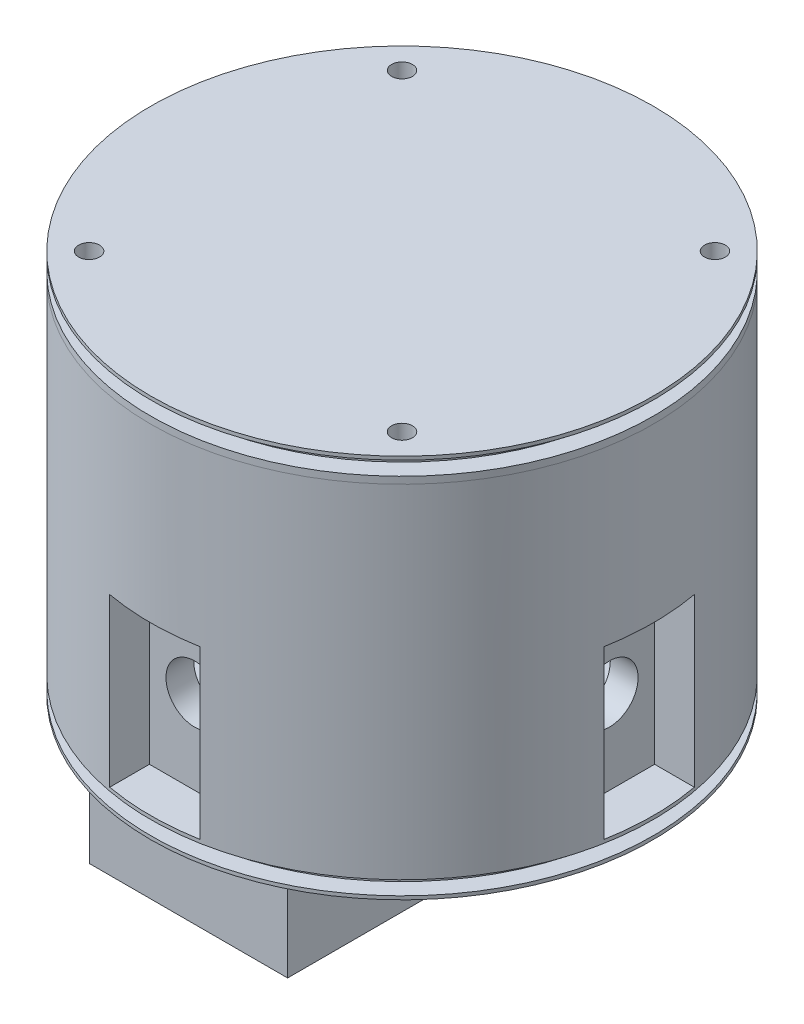
from build123d import *

# Parameters (mm, degrees)
EXTRUDE_START            = -2
SKETCH_1_R               = 72.25
EXTRUDE_8_DEPTH          = 99.5
SKETCH_5_W               = 10.5
SKETCH_5_H               = 22
SKETCH_5_W_2             = 22
SKETCH_5_H_2             = 10.5
CUT_EXTRUDE_1_DEPTH      = 48
SKETCH_40_R              = 8.25
CUT_EXTRUDE_2_DEPTH      = 8
PATTERN_CIRCULAR_1_COUNT = 4
SHELL_START              = -49.642711667
SHELL_6_OUTLINE_W        = 30
SHELL_6_OUTLINE_H        = 50
SHELL_6_DEPTH            = 99.285423334
SHELL_START_2            = -57.642711667
SHELL_6_2_OUTLINE_W      = 30
SHELL_6_2_OUTLINE_H      = 50
SHELL_6_2_OUTLINE_R      = 10.25
SHELL_6_2_DEPTH          = 115.285423334
SHELL_6_3_OUTLINE_W      = 50
SHELL_6_3_OUTLINE_H      = 30
SHELL_6_3_DEPTH          = 99.285423334
SHELL_6_4_OUTLINE_W      = 50
SHELL_6_4_OUTLINE_H      = 30
SHELL_6_4_OUTLINE_R      = 10.25
SHELL_6_4_DEPTH          = 115.285423334
SHELL_6_5_DEPTH          = 97.5
SHELL_START_3            = 50
SHELL_6_6_DEPTH          = 47.5
CUT_EXTRUDE_5_DEPTH      = 48
SKETCH_37_W              = 68
SKETCH_37_H              = 1.5
EXTRUDE_9_DEPTH          = 34
EXTRUDE_9_2_DEPTH        = 34
EXTRUDE_9_3_DEPTH        = 34
EXTRUDE_9_4_DEPTH        = 34
EXTRUDE_9_5_DEPTH        = 34
EXTRUDE_10_DEPTH         = 65
EXTRUDE_11_DEPTH         = 55
EXTRUDE_START_2          = -6
SKETCH_1_26_R            = 72.25
EXTRUDE_13_DEPTH         = 6
SKETCH_47_W              = 57
SKETCH_47_H              = 106
EXTRUDE_12_DEPTH         = 34
SKETCH_50_R              = 6
CUT_EXTRUDE_6_DEPTH      = 6
EXTRUDE_START_3          = 91.5
SKETCH_1_36_R            = 72.25
SKETCH_1_36_R_2          = 71
SKETCH_1_36_R_3          = 68
SKETCH_1_36_R_4          = 67
EXTRUDE_19_DEPTH         = 6
CUT_EXTRUDE_START        = 97.5
SKETCH_1_37_R            = 71
SKETCH_1_37_R_2          = 68
CUT_EXTRUDE_11_DEPTH     = 2
EXTRUDE_START_4          = -97.5
EXTRUDE_20_DEPTH         = 6
SKETCH_62_W              = 5
SKETCH_62_H              = 4
SKETCH_63_R              = 1.5
CUT_EXTRUDE_12_DEPTH     = 6
EXTRUDE_START_5          = 97.5
SKETCH_1_39_R            = 72.25
EXTRUDE_22_DEPTH         = 7
SKETCH_64_R              = 3
CUT_EXTRUDE_13_DEPTH     = 6
CUT_EXTRUDE_START_2      = 6
SKETCH_63_2_R            = 1.5
CUT_EXTRUDE_14_DEPTH     = 6
SKETCH_65_R              = 1.5
CUT_EXTRUDE_15_DEPTH     = 6
SKETCH_66_W              = 5
SKETCH_66_H              = 4
SKETCH_1_41_R            = 68
SKETCH_1_41_R_2          = 67
EXTRUDE_24_DEPTH         = 6
SKETCH_61_R              = 1.5
CUT_EXTRUDE_16_DEPTH     = 6
PATTERN_CIRCULAR_2_COUNT = 4


with BuildPart() as part:
    # 草圖1 → 填料-伸長8 (new body)
    with BuildSketch(Plane(origin=(0, 0, 0), x_dir=(1, 0, 0), z_dir=(0, 1, 0)).offset(EXTRUDE_START)):
        with Locations(Location((0, 0, 0), (0, 0, 270))):
            Circle(SKETCH_1_R)
    extrude(amount=EXTRUDE_8_DEPTH)

    # 草圖5 → 除料-伸長1 (cut)
    with BuildSketch(Plane(origin=(0, 0, 0), x_dir=(1, 0, 0), z_dir=(0, 1, 0))):
        with Locations((64.892711667, 0)):
            Rectangle(SKETCH_5_W, SKETCH_5_H)
        with BuildLine():
            ThreePointArc((72.25, 0), (71.954602966, 6.526684613), (71.070827348, 13))
            Line((71.070827348, 13), (59.642711667, 13))
            Line((59.642711667, 13), (59.642711667, 11))
            Line((59.642711667, 11), (70.142711667, 11))
            Line((70.142711667, 11), (70.142711667, -11))
            Line((70.142711667, -11), (59.642711667, -11))
            Line((59.642711667, -11), (59.642711667, -13))
            Line((59.642711667, -13), (71.070827348, -13))
            ThreePointArc((71.070827348, -13), (71.954602966, -6.526684613), (72.25, 0))
        make_face()
        with Locations((0, 64.892711667)):
            Rectangle(SKETCH_5_W_2, SKETCH_5_H_2)
        with BuildLine():
            ThreePointArc((13, 71.070827348), (0, 72.25), (-13, 71.070827348))
            Line((-13, 71.070827348), (-13, 59.642711667))
            Line((-13, 59.642711667), (-11, 59.642711667))
            Line((-11, 59.642711667), (-11, 70.142711667))
            Line((-11, 70.142711667), (11, 70.142711667))
            Line((11, 70.142711667), (11, 59.642711667))
            Line((11, 59.642711667), (13, 59.642711667))
            Line((13, 59.642711667), (13, 71.070827348))
        make_face()
        with Locations((-64.892711667, 0)):
            Rectangle(SKETCH_5_W, SKETCH_5_H)
        with BuildLine():
            Line((-70.142711667, -11), (-70.142711667, 11))
            Line((-70.142711667, 11), (-59.642711667, 11))
            Line((-59.642711667, 11), (-59.642711667, 13))
            Line((-59.642711667, 13), (-71.070827348, 13))
            ThreePointArc((-71.070827348, 13), (-72.25, 0), (-71.070827348, -13))
            Line((-71.070827348, -13), (-59.642711667, -13))
            Line((-59.642711667, -13), (-59.642711667, -11))
            Line((-59.642711667, -11), (-70.142711667, -11))
        make_face()
        with Locations((0, -64.892711667)):
            Rectangle(SKETCH_5_W_2, SKETCH_5_H_2)
        with BuildLine():
            Line((-13, -59.642711667), (-13, -71.070827348))
            ThreePointArc((-13, -71.070827348), (0, -72.25), (13, -71.070827348))
            Line((13, -71.070827348), (13, -59.642711667))
            Line((13, -59.642711667), (11, -59.642711667))
            Line((11, -59.642711667), (11, -70.142711667))
            Line((11, -70.142711667), (-11, -70.142711667))
            Line((-11, -70.142711667), (-11, -59.642711667))
            Line((-11, -59.642711667), (-13, -59.642711667))
        make_face()
    extrude(amount=CUT_EXTRUDE_1_DEPTH, mode=Mode.SUBTRACT)

    # 草圖40 → 除料-伸長2 (cut)
    with BuildSketch(Plane(origin=(0, 0, -59.642711667), x_dir=(-1, 0, 0), z_dir=(0, 0, -1))):
        with Locations((0, 24)):
            Circle(SKETCH_40_R)
    cut_extrude_2 = extrude(amount=-CUT_EXTRUDE_2_DEPTH, mode=Mode.SUBTRACT)

    # 環狀複製排列1: 除料-伸長2 ×4 about axis
    pattern_circular_1_axis = Axis((0, 0, 0), (0, 1, 0))
    for i in range(1, PATTERN_CIRCULAR_1_COUNT):
        add(cut_extrude_2.rotate(pattern_circular_1_axis, i * 360 / PATTERN_CIRCULAR_1_COUNT), mode=Mode.SUBTRACT)

    # 薄殼6: read off the stored shape, not the designer's step
    # 薄殼6 outline → 薄殼6 (cut)
    with BuildSketch(Plane.XY.offset(SHELL_START)):
        with Locations((0, 25)):
            Rectangle(SHELL_6_OUTLINE_W, SHELL_6_OUTLINE_H)
    extrude(amount=SHELL_6_DEPTH, mode=Mode.SUBTRACT)

    # Shell 6 2 outline → Shell 6 2 (cut)
    with BuildSketch(Plane.XY.offset(SHELL_START_2)):
        with Locations((0, 25)):
            Rectangle(SHELL_6_2_OUTLINE_W, SHELL_6_2_OUTLINE_H)
        with Locations((0, 24)):
            Circle(SHELL_6_2_OUTLINE_R, mode=Mode.SUBTRACT)
    extrude(amount=SHELL_6_2_DEPTH, mode=Mode.SUBTRACT)

    # Shell 6 3 outline → Shell 6 3 (cut)
    with BuildSketch(Plane.YZ.offset(SHELL_START)):
        with Locations((25, 0)):
            Rectangle(SHELL_6_3_OUTLINE_W, SHELL_6_3_OUTLINE_H)
    extrude(amount=SHELL_6_3_DEPTH, mode=Mode.SUBTRACT)

    # Shell 6 4 outline → Shell 6 4 (cut)
    with BuildSketch(Plane.YZ.offset(SHELL_START_2)):
        with Locations((25, 0)):
            Rectangle(SHELL_6_4_OUTLINE_W, SHELL_6_4_OUTLINE_H)
        with Locations((24, 0)):
            Circle(SHELL_6_4_OUTLINE_R, mode=Mode.SUBTRACT)
    extrude(amount=SHELL_6_4_DEPTH, mode=Mode.SUBTRACT)

    # Shell 6 5 outline → Shell 6 5 (cut)
    with BuildSketch(Plane(origin=(0, 0, 0), x_dir=(1, 0, 0), z_dir=(0, 1, 0))):
        with BuildLine():
            Line((15, 15), (68.62989509, 15))
            ThreePointArc((68.62989509, 15), (49.674251378, 49.674251378), (15, 68.62989509))
            Line((15, 68.62989509), (15, 15))
        make_face()
        with BuildLine():
            ThreePointArc((15, -68.62989509), (49.674251378, -49.674251378), (68.62989509, -15))
            Line((68.62989509, -15), (15, -15))
            Line((15, -15), (15, -68.62989509))
        make_face()
        with BuildLine():
            Line((-15, 15), (-15, 68.62989509))
            ThreePointArc((-15, 68.62989509), (-49.674251378, 49.674251378), (-68.62989509, 15))
            Line((-68.62989509, 15), (-15, 15))
        make_face()
        with BuildLine():
            ThreePointArc((-68.62989509, -15), (-49.674251378, -49.674251378), (-15, -68.62989509))
            Line((-15, -68.62989509), (-15, -15))
            Line((-15, -15), (-68.62989509, -15))
        make_face()
    extrude(amount=SHELL_6_5_DEPTH, mode=Mode.SUBTRACT)

    # Shell 6 6 outline → Shell 6 6 (cut)
    with BuildSketch(Plane(origin=(0, 0, 0), x_dir=(1, 0, 0), z_dir=(0, 1, 0)).offset(SHELL_START_3)):
        with BuildLine():
            ThreePointArc((68.62989509, -15), (70.25, 0), (68.62989509, 15))
            Line((68.62989509, 15), (15, 15))
            Line((15, 15), (15, 68.62989509))
            ThreePointArc((15, 68.62989509), (0, 70.25), (-15, 68.62989509))
            Line((-15, 68.62989509), (-15, 15))
            Line((-15, 15), (-68.62989509, 15))
            ThreePointArc((-68.62989509, 15), (-70.25, 0), (-68.62989509, -15))
            Line((-68.62989509, -15), (-15, -15))
            Line((-15, -15), (-15, -68.62989509))
            ThreePointArc((-15, -68.62989509), (0, -70.25), (15, -68.62989509))
            Line((15, -68.62989509), (15, -15))
            Line((15, -15), (68.62989509, -15))
        make_face()
    extrude(amount=SHELL_6_6_DEPTH, mode=Mode.SUBTRACT)

    # 草圖43 → 除料-伸長5 (cut)
    with BuildSketch(Plane(origin=(0, 0, 0), x_dir=(1, 0, 0), z_dir=(0, 1, 0))):
        Polygon((15.617248129, 51.642711667), (-24.146545114, 51.642711667), (-51.642711667, 15.617248129), (-51.642711667, -24.146545114), (-15.617248129, -51.642711667), (24.146545114, -51.642711667), (51.642711667, -15.617248129), (51.642711667, 24.146545114), align=None)
    extrude(amount=CUT_EXTRUDE_5_DEPTH, mode=Mode.SUBTRACT)

    # 草圖1<26> → 填料-伸長13 (add)
    with BuildSketch(Plane(origin=(0, 0, 0), x_dir=(1, 0, 0), z_dir=(0, 1, 0)).offset(EXTRUDE_START_2)):
        with Locations(Location((0, 0, 0), (0, 0, 270))):
            Circle(SKETCH_1_26_R)
    extrude(amount=EXTRUDE_13_DEPTH)

    # 草圖50 → 除料-伸長6 (cut)
    with BuildSketch(Plane(origin=(0, 0, 0), x_dir=(1, 0, 0), z_dir=(0, 1, 0))):
        with Locations(Location((18.322761596, 49.972985564, 0), (0, 0, 270))):
            Circle(SKETCH_50_R)
        with Locations(Location((-49.972985564, -18.322761596, 0), (0, 0, 270))):
            Circle(SKETCH_50_R)
    extrude(amount=-CUT_EXTRUDE_6_DEPTH, mode=Mode.SUBTRACT)

    # 草圖1<36> → 填料-伸長19 (add)
    # profile 1 of 3: a face of its own
    with BuildSketch(Plane(origin=(0, 0, 0), x_dir=(1, 0, 0), z_dir=(0, 1, 0)).offset(EXTRUDE_START_3)):
        with Locations(Location((0, 0, 0), (0, 0, 270))):
            Circle(SKETCH_1_36_R)
        Circle(SKETCH_1_36_R_2, mode=Mode.SUBTRACT)
    # profile 2 of 3: a face of its own
    with BuildSketch(Plane(origin=(0, 0, 0), x_dir=(1, 0, 0), z_dir=(0, 1, 0)).offset(EXTRUDE_START_3)):
        Circle(SKETCH_1_36_R_2)
        Circle(SKETCH_1_36_R_3, mode=Mode.SUBTRACT)
    # profile 3 of 3: a face of its own
    with BuildSketch(Plane(origin=(0, 0, 0), x_dir=(1, 0, 0), z_dir=(0, 1, 0)).offset(EXTRUDE_START_3)):
        Circle(SKETCH_1_36_R_3)
        with Locations(Location((0, 0, 0), (0, 0, 270))):
            Circle(SKETCH_1_36_R_4, mode=Mode.SUBTRACT)
    extrude(amount=EXTRUDE_19_DEPTH)

    # 草圖1<37> → 除料-伸長11 (cut)
    with BuildSketch(Plane(origin=(0, 0, 0), x_dir=(1, 0, 0), z_dir=(0, 1, 0)).offset(CUT_EXTRUDE_START)):
        with Locations(Location((0, 0, 0), (0, 0, 270))):
            Circle(SKETCH_1_37_R)
        with Locations(Location((0, 0, 0), (0, 0, 270))):
            Circle(SKETCH_1_37_R_2, mode=Mode.SUBTRACT)
    extrude(amount=-CUT_EXTRUDE_11_DEPTH, mode=Mode.SUBTRACT)

    # 草圖57 → 填料-伸長20 (add)
    with BuildSketch(Plane.XZ.offset(6).offset(EXTRUDE_START_4)):
        with BuildLine():
            Line((-49.280774487, 45.39168719), (-45, 41.110912703))
            Line((-45, 41.110912703), (-41.110912703, 45))
            Line((-41.110912703, 45), (-45.39168719, 49.280774487))
            ThreePointArc((-45.39168719, 49.280774487), (-47.376154339, 47.376154339), (-49.280774487, 45.39168719))
        make_face()
        with BuildLine():
            Line((-45, -41.110912703), (-49.280774487, -45.39168719))
            ThreePointArc((-49.280774487, -45.39168719), (-47.376154339, -47.376154339), (-45.39168719, -49.280774487))
            Line((-45.39168719, -49.280774487), (-41.110912703, -45))
            Line((-41.110912703, -45), (-45, -41.110912703))
        make_face()
        with BuildLine():
            Line((41.110912703, -45), (45.39168719, -49.280774487))
            ThreePointArc((45.39168719, -49.280774487), (47.376154339, -47.376154339), (49.280774487, -45.39168719))
            Line((49.280774487, -45.39168719), (45, -41.110912703))
            Line((45, -41.110912703), (41.110912703, -45))
        make_face()
        with BuildLine():
            ThreePointArc((49.280774487, 45.39168719), (47.376154339, 47.376154339), (45.39168719, 49.280774487))
            Line((45.39168719, 49.280774487), (41.110912703, 45))
            Line((41.110912703, 45), (45, 41.110912703))
            Line((45, 41.110912703), (49.280774487, 45.39168719))
        make_face()
    extrude(amount=-EXTRUDE_20_DEPTH)

    # 草圖62 → 除料-旋轉2 (revolve, cut)
    with BuildSketch(Plane(origin=(0, 0, 0), x_dir=(-0.7071067811865476, 0, 0.7071067811865476), z_dir=(-0.7071067811865476, 0, -0.7071067811865476)), mode=Mode.PRIVATE) as cut_revolve_2_sk:
        with Locations((-69.75, -3)):
            Rectangle(SKETCH_62_W, SKETCH_62_H)
    revolve(cut_revolve_2_sk.sketch.rotate(Axis((0, 0, 0), (0, 1, 0)), 45), axis=Axis((0, 0, 0), (0, 1, 0)), mode=Mode.SUBTRACT)

    # 草圖63 → 除料-伸長12 (cut)
    with BuildSketch(Plane(origin=(0, 97.5, 0), x_dir=(1, 0, 0), z_dir=(0, 1, 0))):
        with Locations(Location((-45, 45, 0), (0, 0, 270))):
            Circle(SKETCH_63_R)
        with Locations(Location((45, 45, 0), (0, 0, 270))):
            Circle(SKETCH_63_R)
        with Locations(Location((45, -45, 0), (0, 0, 270))):
            Circle(SKETCH_63_R)
        with Locations(Location((-45, -45, 0), (0, 0, 270))):
            Circle(SKETCH_63_R)
    extrude(amount=-CUT_EXTRUDE_12_DEPTH, mode=Mode.SUBTRACT)

    # 草圖1<41> → 填料-伸長24 (add)
    with BuildSketch(Plane(origin=(0, 0, 0), x_dir=(1, 0, 0), z_dir=(0, 1, 0)).offset(EXTRUDE_START_3)):
        with Locations(Location((0, 0, 0), (0, 0, 270))):
            Circle(SKETCH_1_41_R)
        Circle(SKETCH_1_41_R_2, mode=Mode.SUBTRACT)
    extrude(amount=EXTRUDE_24_DEPTH)

    # 草圖61 → 除料-伸長16 (cut)
    with BuildSketch(Plane(origin=(0, 0, 0), x_dir=(1, 0, 0), z_dir=(0, 1, 0))):
        with Locations(Location((-42.426406871, 0, 0), (0, 0, 90))):
            Circle(SKETCH_61_R)
    cut_extrude_16 = extrude(amount=-CUT_EXTRUDE_16_DEPTH, mode=Mode.SUBTRACT)

    # 環狀複製排列2: 除料-伸長16 ×4 about axis
    pattern_circular_2_axis = Axis((0, 0, 0), (0, 1, 0))
    for i in range(1, PATTERN_CIRCULAR_2_COUNT):
        add(cut_extrude_16.rotate(pattern_circular_2_axis, i * 360 / PATTERN_CIRCULAR_2_COUNT), mode=Mode.SUBTRACT)


with BuildPart() as body_2:
    # 草圖37 → 填料-伸長9 (new, symmetric)
    with BuildSketch(Plane(origin=(0, 0, 0), x_dir=(-0.7071067811865476, 0, 0.7071067811865476), z_dir=(-0.7071067811865476, 0, -0.7071067811865476))):
        with Locations((0, 48.75)):
            Rectangle(SKETCH_37_W, SKETCH_37_H)
    extrude(amount=EXTRUDE_9_DEPTH, both=True)


with BuildPart() as body_3:
    # 草圖37 → Extrude 9 2 (new, symmetric)
    with BuildSketch(Plane(origin=(0, 0, 0), x_dir=(-0.7071067811865476, 0, 0.7071067811865476), z_dir=(-0.7071067811865476, 0, -0.7071067811865476))):
        Polygon((-34, 33), (-34, 31.5), (-31.5, 31.5), (34, 31.5), (34, 33), align=None)
    extrude(amount=EXTRUDE_9_2_DEPTH, both=True)


with BuildPart() as body_4:
    # 草圖37 → Extrude 9 3 (new, symmetric)
    with BuildSketch(Plane(origin=(0, 0, 0), x_dir=(-0.7071067811865476, 0, 0.7071067811865476), z_dir=(-0.7071067811865476, 0, -0.7071067811865476))):
        Polygon((-34, 16.5), (-34, 15), (34, 15), (34, 16.5), (-31.5, 16.5), align=None)
    extrude(amount=EXTRUDE_9_3_DEPTH, both=True)


with BuildPart() as body_5:
    # 草圖37 → Extrude 9 4 (new, symmetric)
    with BuildSketch(Plane(origin=(0, 0, 0), x_dir=(-0.7071067811865476, 0, 0.7071067811865476), z_dir=(-0.7071067811865476, 0, -0.7071067811865476))):
        with Locations((0, 65.25)):
            Rectangle(SKETCH_37_W, SKETCH_37_H)
    extrude(amount=EXTRUDE_9_4_DEPTH, both=True)


with BuildPart() as body_6:
    # 草圖37 → Extrude 9 5 (new, symmetric)
    with BuildSketch(Plane(origin=(0, 0, 0), x_dir=(-0.7071067811865476, 0, 0.7071067811865476), z_dir=(-0.7071067811865476, 0, -0.7071067811865476))):
        with Locations((0, 81.75)):
            Rectangle(SKETCH_37_W, SKETCH_37_H)
    extrude(amount=EXTRUDE_9_5_DEPTH, both=True)


with BuildPart() as body_7:
    # 草圖41 → 填料-伸長10 (new body)
    with BuildSketch(Plane(origin=(0, 0, 0), x_dir=(1, 0, 0), z_dir=(0, 1, 0))):
        Polygon((48.371425758, -10.597532563), (10.187659574, -48.781298747), (22.915581635, -61.509220808), (61.099347819, -23.325454624), align=None)
    extrude(amount=EXTRUDE_10_DEPTH)


with BuildPart() as body_8:
    # 草圖46 → 填料-伸長11 (new body)
    with BuildSketch(Plane(origin=(0, 0, 0), x_dir=(1, 0, 0), z_dir=(0, 1, 0))):
        Polygon((-21.653402574, -57.008741633), (-22.714062746, -58.069401805), (-58.069401805, -22.714062746), (-57.008741633, -21.653402574), align=None)
    extrude(amount=EXTRUDE_11_DEPTH)


with BuildPart() as body_9:
    # 草圖47 → 填料-伸長12 (new body)
    with BuildSketch(Plane(origin=(0, 0, 0), x_dir=(1, 0, 0), z_dir=(0, 1, 0)).offset(EXTRUDE_START_2)):
        with Locations((-8.402499724, 0)):
            Rectangle(SKETCH_47_W, SKETCH_47_H)
    extrude(amount=-EXTRUDE_12_DEPTH)


with BuildPart() as body_10:
    # 草圖1<39> → 填料-伸長22 (new body)
    with BuildSketch(Plane(origin=(0, 0, 0), x_dir=(1, 0, 0), z_dir=(0, 1, 0)).offset(EXTRUDE_START_5)):
        with Locations(Location((0, 0, 0), (0, 0, 270))):
            Circle(SKETCH_1_39_R)
    extrude(amount=EXTRUDE_22_DEPTH)

    # 草圖64 → 除料-伸長13 (cut)
    with BuildSketch(Plane(origin=(0, 104.5, 0), x_dir=(1, 0, 0), z_dir=(0, 1, 0))):
        with Locations(Location((-45, 45, 0), (0, 0, 270))):
            Circle(SKETCH_64_R)
        with Locations(Location((45, 45, 0), (0, 0, 270))):
            Circle(SKETCH_64_R)
        with Locations(Location((45, -45, 0), (0, 0, 270))):
            Circle(SKETCH_64_R)
        with Locations(Location((-45, -45, 0), (0, 0, 270))):
            Circle(SKETCH_64_R)
    extrude(amount=-CUT_EXTRUDE_13_DEPTH, mode=Mode.SUBTRACT)

    # 草圖63<2> → 除料-伸長14 (cut)
    with BuildSketch(Plane(origin=(0, 97.5, 0), x_dir=(1, 0, 0), z_dir=(0, 1, 0)).offset(CUT_EXTRUDE_START_2)):
        with Locations(Location((-45, 45, 0), (0, 0, 270))):
            Circle(SKETCH_63_2_R)
        with Locations(Location((45, 45, 0), (0, 0, 270))):
            Circle(SKETCH_63_2_R)
        with Locations(Location((45, -45, 0), (0, 0, 270))):
            Circle(SKETCH_63_2_R)
        with Locations(Location((-45, -45, 0), (0, 0, 270))):
            Circle(SKETCH_63_2_R)
    extrude(amount=-CUT_EXTRUDE_14_DEPTH, mode=Mode.SUBTRACT)

    # 草圖65 → 除料-伸長15 (cut)
    with BuildSketch(Plane.XZ.offset(-97.5)):
        with Locations(Location((-42.426406871, 0, 0), (0, 0, 270))):
            Circle(SKETCH_65_R)
        with Locations(Location((0, 42.426406871, 0), (0, 0, 270))):
            Circle(SKETCH_65_R)
        with Locations(Location((42.426406871, 0, 0), (0, 0, 270))):
            Circle(SKETCH_65_R)
        with Locations(Location((0, -42.426406871, 0), (0, 0, 270))):
            Circle(SKETCH_65_R)
    extrude(amount=-CUT_EXTRUDE_15_DEPTH, mode=Mode.SUBTRACT)

    # 草圖66 → 除料-旋轉3 (revolve, cut)
    with BuildSketch(Plane(origin=(0, 0, 0), x_dir=(-0.7071067811865476, 0, 0.7071067811865476), z_dir=(-0.7071067811865476, 0, -0.7071067811865476)), mode=Mode.PRIVATE) as cut_revolve_3_sk:
        with Locations((-69.75, 101.5)):
            Rectangle(SKETCH_66_W, SKETCH_66_H)
    revolve(cut_revolve_3_sk.sketch.rotate(Axis((0, 0, 0), (0, 1, 0)), 45), axis=Axis((0, 0, 0), (0, 1, 0)), mode=Mode.SUBTRACT)


solid = Compound([part.part, body_2.part, body_3.part, body_4.part, body_5.part, body_6.part, body_7.part, body_8.part, body_9.part, body_10.part])
